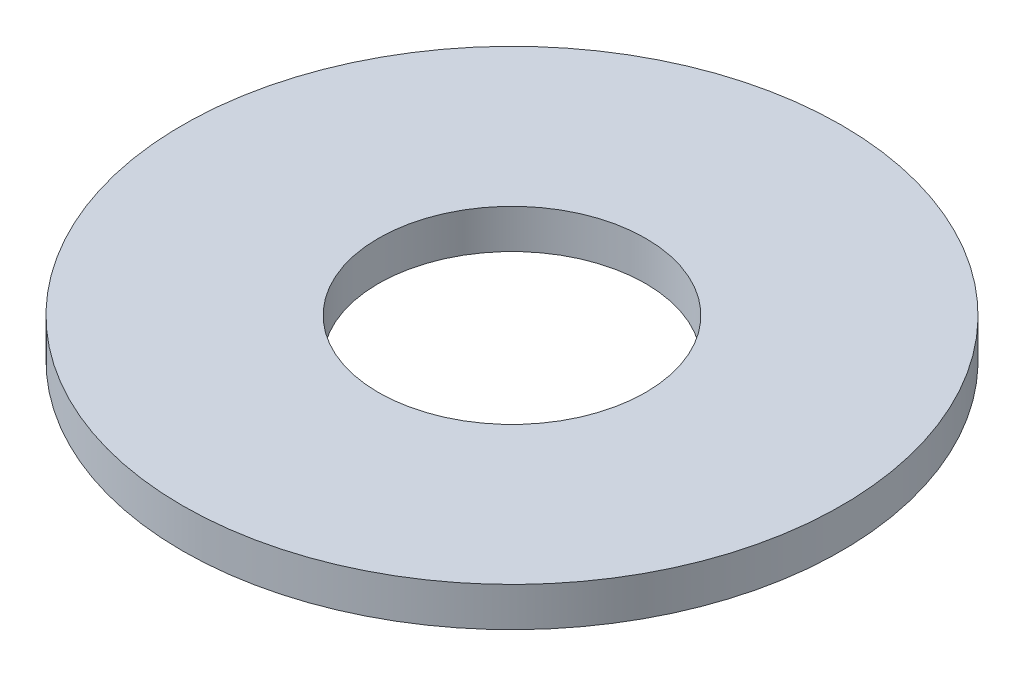
from build123d import *

# Parameters (mm, degrees)
SKETCH1_R           = 92.5
BOSS_EXTRUDE1_DEPTH = 11
SKETCH2_R           = 37.5
CUT_EXTRUDE1_DEPTH  = 132.276425911


with BuildPart() as part:
    # Sketch1 → Boss-Extrude1 (new body)
    with BuildSketch(Plane(origin=(0, 0, 0), x_dir=(1, 0, 0), z_dir=(0, 1, 0))):
        Circle(SKETCH1_R)
    extrude(amount=BOSS_EXTRUDE1_DEPTH)

    # Sketch2 → Cut-Extrude1 (cut, through all)
    with BuildSketch(Plane(origin=(0, 0, 0), x_dir=(1, 0, 0), z_dir=(0, 1, 0))):
        Circle(SKETCH2_R)
    extrude(amount=CUT_EXTRUDE1_DEPTH, mode=Mode.SUBTRACT)


solid = part.part
